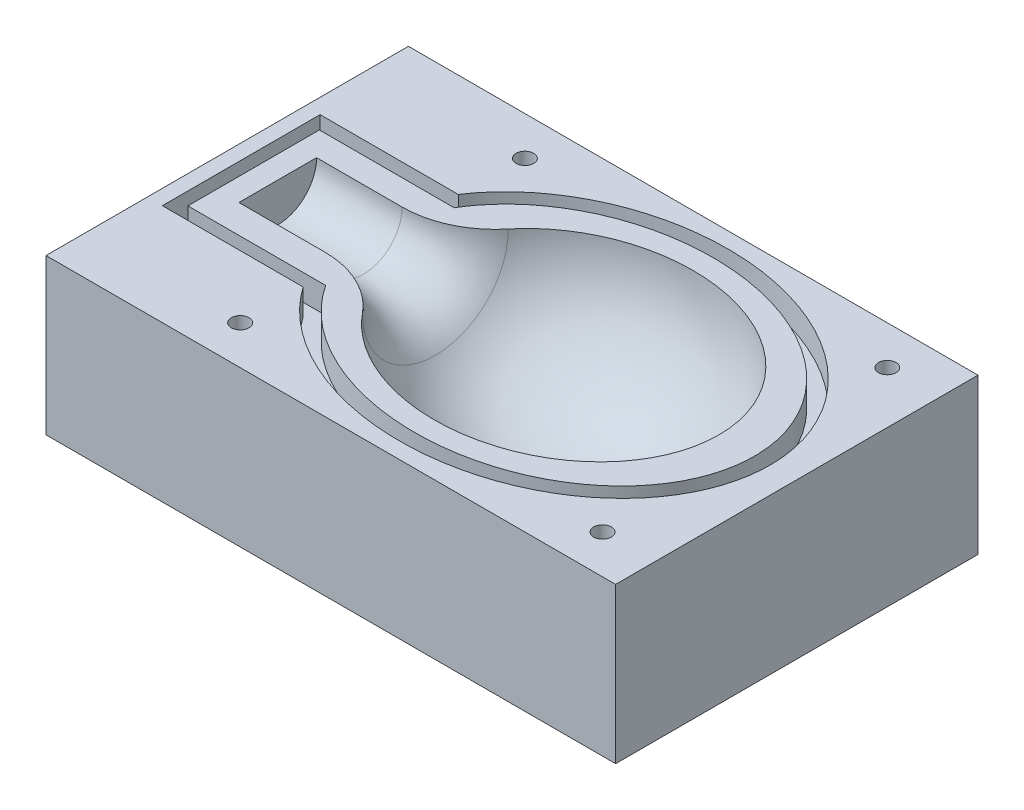
from build123d import *

# Parameters (mm, degrees)
ESQUISSE1_W                              = 130
ESQUISSE1_H                              = 30
BOSS_EXTRU_1_DEPTH                       = 70
ENL_VEMENT_DE_MATI_RE_R_VOLUTION47_ANGLE = 180
ENL_VEMENT_START                         = -55.237277286
ENL_VEMENT_DE_MATI_RE_R_VOLUTION48_DEPTH = 26.619101243
CONG_1_R                                 = 18
ESQUISSE10_W                             = 19.973037842
ESQUISSE10_H                             = 30
ENL_V_MAT_EXTRU_2_DEPTH                  = 97.695398184
ENL_V_MAT_EXTRU_5_DEPTH                  = 5
ESQUISSE15_R                             = 1.7
ENL_V_MAT_EXTRU_7_DEPTH                  = 101.124922107


# Read off the part's stored shape, not the designer's step: Enlèvement de matière-Révolution48
with BuildPart() as part:
    # Esquisse1 → Boss.-Extru.1 (new body)
    with BuildSketch(Plane.XY):
        Rectangle(ESQUISSE1_W, ESQUISSE1_H)
    extrude(amount=BOSS_EXTRU_1_DEPTH)

    # Esquisse6 → Enlèvement de matière-Révolution47 (revolve, cut)
    with BuildSketch(Plane(origin=(0, 15, 0), x_dir=(1, 0, 0), z_dir=(0, 1, 0))):
        with BuildLine():
            Line((-30, -35), (30, -35))
            add(Edge.make_bspline(
                [(30, -35), (30, -10), (0, -10), (-30, -10), (-30, -35)],
                knots=[0, 0, 0, 1.570796327, 1.570796327, 3.141592654, 3.141592654, 3.141592654], degree=2, weights=[1, 0.707106781, 1, 0.707106781, 1]))
        make_face()
    revolve(axis=Axis((65, 15, 35), (-1, 0, 0)), revolution_arc=ENL_VEMENT_DE_MATI_RE_R_VOLUTION47_ANGLE, mode=Mode.SUBTRACT)

    # Enlèvement de matière-Révolution48 outli → Enlèvement de matière-Révolution48 (cut)
    with BuildSketch(Plane.YZ.offset(ENL_VEMENT_START)):
        with BuildLine():
            Line((15, 27.5), (15, 42.5))
            ThreePointArc((15, 42.5), (7.5, 35), (15, 27.5))
        make_face()
    extrude(amount=ENL_VEMENT_DE_MATI_RE_R_VOLUTION48_DEPTH, mode=Mode.SUBTRACT)

    # Congé1
    cong_1_edges = [part.edges().sort_by_distance(p)[0] for p in [
        (-28.618176043, 7.5, 35),
    ]]
    fillet(cong_1_edges, radius=CONG_1_R)

    # Esquisse10 → Enlèv. mat.-Extru.2 (cut, through all)
    with BuildSketch(Plane(origin=(0, 0, 0), x_dir=(-1, 0, 0), z_dir=(0, 0, -1))):
        with Locations((-55.013481079, 0)):
            Rectangle(ESQUISSE10_W, ESQUISSE10_H)
    extrude(amount=-ENL_V_MAT_EXTRU_2_DEPTH, mode=Mode.SUBTRACT)

    # Esquisse14 → Enlèv. mat.-Extru.5 (cut)
    with BuildSketch(Plane(origin=(0, 15, 0), x_dir=(1, 0, 0), z_dir=(0, 1, 0))):
        with BuildLine():
            Line((-36.95065792, -22.593731953), (-33.568216071, -22.593731953))
            add(Edge.make_bspline(
                [(-32.969763, -47.992109896), (-11.968044376, -80.456384186), (23.634832969, -57.413436774), (59.237710315, -34.370489362), (22.565908506, -12.048229698), (-14.105893303, 10.274029966), (-33.568216071, -22.593731953)],
                knots=[3.621962513, 3.621962513, 3.621962513, 5.414642661, 5.414642661, 7.207322809, 7.207322809, 9.000002957, 9.000002957, 9.000002957], degree=2, weights=[1, 0.624472717, 1, 0.624472717, 1, 0.624472717, 1]))
            Line((-32.969763, -47.992109896), (-36.439122288, -47.992109896))
            add(Edge.make_bspline(
                [(-36.439122288, -47.992109896), (-35.734455038, -49.237206185), (-34.899635372, -50.4303054)],
                knots=[3.575076272, 3.575076272, 3.575076272, 3.671550289, 3.671550289, 3.671550289], degree=2, weights=[1, 0.979509213, 0.961188751]))
            add(Edge.make_bspline(
                [(-34.899635372, -50.4303054), (-11.819428822, -83.415843998), (25.026969924, -59.963213412), (65.234193612, -34.371427073), (24.010934913, -9.515816182), (-13.543091018, 13.127426623), (-35.401513383, -19.963295045)],
                knots=[3.671550289, 3.671550289, 3.671550289, 5.396765185, 5.396765185, 7.218454098, 7.218454098, 8.937188842, 8.937188842, 8.937188842], degree=2, weights=[0.961188751, 0.633569616, 1, 0.613078829, 1, 0.634945981, 0.958737375]))
            add(Edge.make_bspline(
                [(-35.401513383, -19.963295045), (-36.251462308, -21.250003794), (-36.95065792, -22.593731953)],
                knots=[8.937188842, 8.937188842, 8.937188842, 9.04014301, 9.04014301, 9.04014301], degree=2, weights=[0.958737375, 0.978132848, 1]))
        make_face()
        with BuildLine():
            Line((-59.600015614, -22.593731953), (-36.95065792, -22.593731953))
            add(Edge.make_bspline(
                [(-35.401513383, -19.963295045), (-36.251462308, -21.250003794), (-36.95065792, -22.593731953)],
                knots=[8.937188842, 8.937188842, 8.937188842, 9.04014301, 9.04014301, 9.04014301], degree=2, weights=[0.958737375, 0.978132848, 1]))
            Line((-35.401513383, -19.963295045), (-62.094279206, -19.963295045))
            Line((-62.094279206, -19.963295045), (-62.094279206, -50.4303054))
            Line((-62.094279206, -50.4303054), (-34.899635372, -50.4303054))
            add(Edge.make_bspline(
                [(-36.439122288, -47.992109896), (-35.734455038, -49.237206185), (-34.899635372, -50.4303054)],
                knots=[3.575076272, 3.575076272, 3.575076272, 3.671550289, 3.671550289, 3.671550289], degree=2, weights=[1, 0.979509213, 0.961188751]))
            Line((-36.439122288, -47.992109896), (-59.600015614, -47.992109896))
            Line((-59.600015614, -47.992109896), (-59.600015614, -22.593731953))
        make_face()
    extrude(amount=-ENL_V_MAT_EXTRU_5_DEPTH, mode=Mode.SUBTRACT)

    # Esquisse15 → Enlèv. mat.-Extru.7 (cut, through all)
    with BuildSketch(Plane(origin=(0, 15, 0), x_dir=(1, 0, 0), z_dir=(0, 1, 0))):
        with Locations(Location((35, -7.5, 0), (0, 0, 270))):
            Circle(ESQUISSE15_R)
        with Locations(Location((35, -62.5, 0), (0, 0, 270))):
            Circle(ESQUISSE15_R)
        with Locations(Location((-35, -62.5, 0), (0, 0, 270))):
            Circle(ESQUISSE15_R)
        with Locations(Location((-35, -7.5, 0), (0, 0, 270))):
            Circle(ESQUISSE15_R)
    extrude(amount=-ENL_V_MAT_EXTRU_7_DEPTH, mode=Mode.SUBTRACT)


solid = part.part
